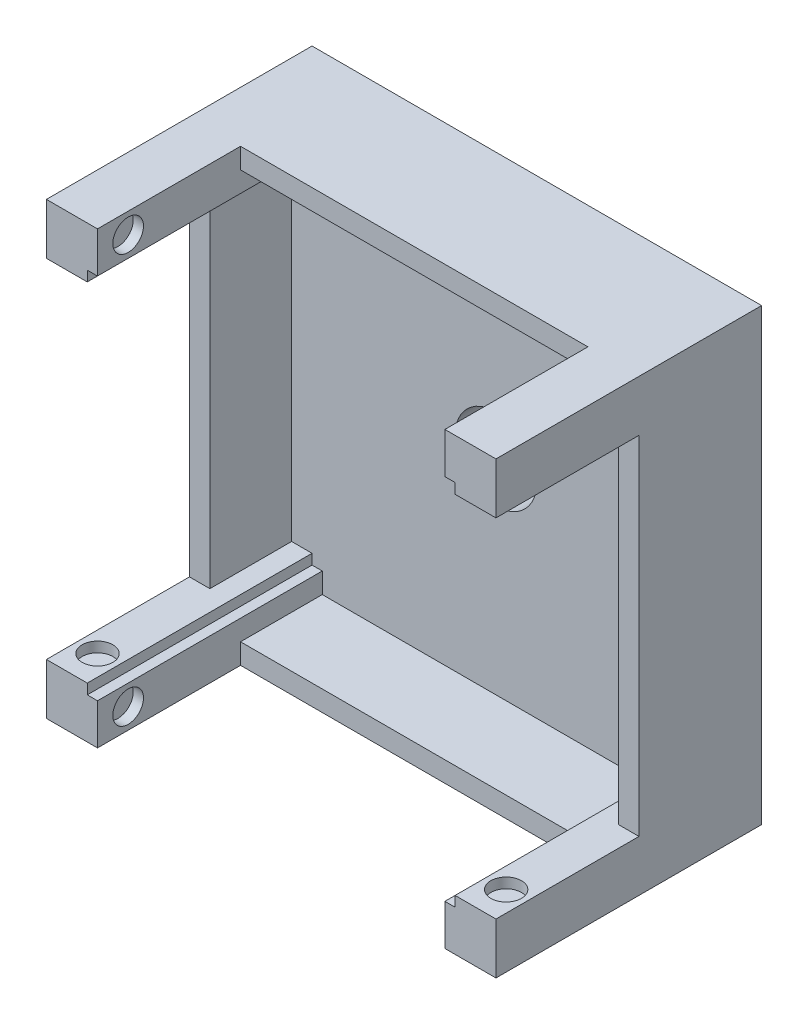
from build123d import *

# Parameters (mm, degrees)
SKETCH_1_W          = 220
SKETCH_1_H          = 220
EXTRUDE_1_DEPTH     = 20
EXTRUDE_3_DEPTH     = 110
SKETCH_4_R          = 7.5
CUT_EXTRUDE_2_DEPTH = 5
SKETCH_7_R          = 7.5
CUT_EXTRUDE_3_DEPTH = 5
SKETCH_10_W         = 40
SKETCH_10_H         = 170
EXTRUDE_5_DEPTH     = 10
SKETCH_11_W         = 170
SKETCH_11_H         = 40
EXTRUDE_6_DEPTH     = 10
SKETCH_12_W         = 40
SKETCH_12_H         = 170
EXTRUDE_7_DEPTH     = 10
SKETCH_13_W         = 170
SKETCH_13_H         = 40
EXTRUDE_8_DEPTH     = 10
SKETCH_16_R         = 20
CUT_EXTRUDE_6_DEPTH = 20


# Read off the part's stored shape, not the designer's step: 镜向2, 镜向5
with BuildPart() as part:
    # 草图1 → 凸台-拉伸1 (new body)
    with BuildSketch(Plane.XY):
        Rectangle(SKETCH_1_W, SKETCH_1_H)
    extrude(amount=EXTRUDE_1_DEPTH)

    # 草图2 → 凸台-拉伸3 (add)
    with BuildSketch(Plane.XY.offset(20)):
        Polygon((85, 110), (110, 110), (110, 85), (90, 85), (90, 90), (85, 90), align=None)
    extrude(amount=EXTRUDE_3_DEPTH)

    # 草图4 → 切除-拉伸2 (cut)
    with BuildSketch(Plane(origin=(0, 85, 0), x_dir=(-1, 0, 0), z_dir=(0, -1, 0))):
        with Locations(Location((-100, -115, 0), (0, 0, 90))):
            Circle(SKETCH_4_R)
    extrude(amount=-CUT_EXTRUDE_2_DEPTH, mode=Mode.SUBTRACT)

    # 草图7 → 切除-拉伸3 (cut)
    with BuildSketch(Plane.ZY.offset(-85)):
        with Locations((115, 100)):
            Circle(SKETCH_7_R)
    extrude(amount=-CUT_EXTRUDE_3_DEPTH, mode=Mode.SUBTRACT)

    # 镜向2: part across plane


with BuildPart() as part_1:
    add(part.part)
    add(part.part.mirror(Plane(origin=(0, 0, 0), x_dir=(0, 0, 1), z_dir=(1, 0, 0))))

    # 镜向5: part across plane


with BuildPart() as part_2:
    add(part_1.part)
    add(part_1.part.mirror(Plane.ZX))

    # 草图10 → 凸台-拉伸5 (add)
    with BuildSketch(Plane(origin=(110, 0, 0), x_dir=(0, 0, -1), z_dir=(1, 0, 0))):
        with Locations((-40, 0)):
            Rectangle(SKETCH_10_W, SKETCH_10_H)
    extrude(amount=-EXTRUDE_5_DEPTH)

    # 草图11 → 凸台-拉伸6 (add)
    with BuildSketch(Plane.XZ.offset(110)):
        with Locations((0, 40)):
            Rectangle(SKETCH_11_W, SKETCH_11_H)
    extrude(amount=-EXTRUDE_6_DEPTH)

    # 草图12 → 凸台-拉伸7 (add)
    with BuildSketch(Plane.ZY.offset(110)):
        with Locations((40, 0)):
            Rectangle(SKETCH_12_W, SKETCH_12_H)
    extrude(amount=-EXTRUDE_7_DEPTH)

    # 草图13 → 凸台-拉伸8 (add)
    with BuildSketch(Plane(origin=(0, 110, 0), x_dir=(1, 0, 0), z_dir=(0, 1, 0))):
        with Locations((0, -40)):
            Rectangle(SKETCH_13_W, SKETCH_13_H)
    extrude(amount=-EXTRUDE_8_DEPTH)

    # 草图16 → 切除-拉伸6 (cut)
    with BuildSketch(Plane.XY.offset(20)):
        Circle(SKETCH_16_R)
    extrude(amount=-CUT_EXTRUDE_6_DEPTH, mode=Mode.SUBTRACT)


solid = part_2.part
